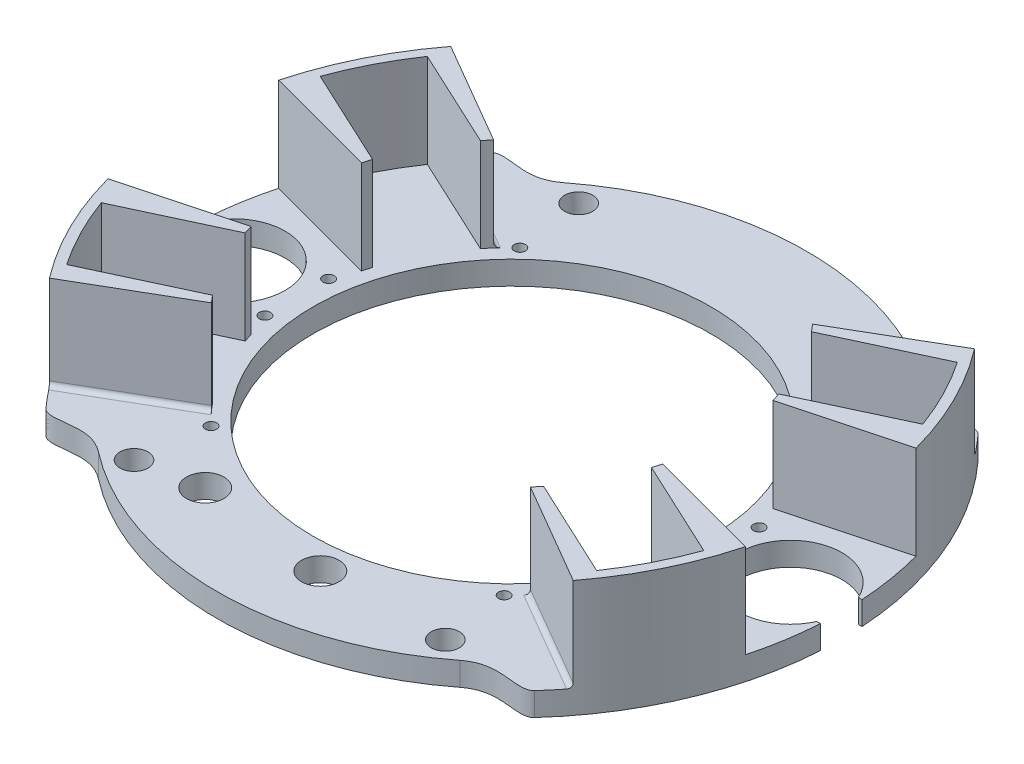
from build123d import *
from build123d.topology import SkipClean

# Parameters (mm, degrees)
SKETCH1_R                                    = 89.535
SKETCH1_R_2                                  = 53.975
BASE_DEPTH                                   = 6.35
NOCE_START                                   = -6.35
NOCE_CONE_PYROS_DEPTH                        = 6.35
BATTERY_1_HOLDER_DEPTH                       = 25.4
BATTERY_4_HOLDER_COPY_1_DEPTH                = 25.4
BATTERY_4_HOLDER_COPY_2_DEPTH                = 25.4
SKETCH4_R                                    = 3.81
BOLT_HOLE_DEPTH                              = 6.35
BOLT_HOLE_4_COPY_1_SKETCH_R                  = 3.81
BOLT_HOLE_4_COPY_1_DEPTH                     = 6.35
BOLT_HOLE_4_COPY_2_SKETCH_R                  = 3.81
BOLT_HOLE_4_COPY_2_DEPTH                     = 6.35
SKETCH11_R                                   = 5.08
CUT_EXTRUDE2_DEPTH                           = 6.35
SKETCH13_R                                   = 3.175
CUT_EXTRUDE3_DEPTH                           = 3.175
SKETCH14_R                                   = 1.524
CUT_EXTRUDE4_DEPTH                           = 3.175
FILLET3_R                                    = 1.27
SKETCH15_R                                   = 1.524
HATCH_MOUNT_DEPTH                            = 6.35
HATCH_MOUNT_MIRROR_AT_THE_SECOND_PLANE_C_R   = 1.524
HATCH_MOUNT_MIRROR_AT_THE_SECOND_PLA_2_DEPTH = 6.35
NOTCH_START                                  = -6.35
NOTCH_DEPTH                                  = 6.35


# Read off the part's stored shape, not the designer's step: Notch
with BuildPart() as part:
    # Sketch1 → Base (new body)
    with BuildSketch(Plane(origin=(0, 0, 0), x_dir=(1, 0, 0), z_dir=(0, 1, 0))):
        with Locations(Location((0, 0, 0), (0, 0, 270))):
            Circle(SKETCH1_R)
        with Locations(Location((0, 0, 0), (0, 0, 270))):
            Circle(SKETCH1_R_2, mode=Mode.SUBTRACT)
    extrude(amount=BASE_DEPTH)

    # Sketch2 → Noce Cone Pyros (cut)
    with BuildSketch(Plane(origin=(0, 6.35, 0), x_dir=(1, 0, 0), z_dir=(0, 1, 0)).offset(NOCE_START)):
        with BuildLine():
            Line((89.3564, 5.652439), (88.3404, 5.652439))
            ThreePointArc((88.3404, 5.652439), (61.595, 0), (88.3404, -5.652439))
            Line((88.3404, -5.652439), (89.3564, -5.652439))
            ThreePointArc((89.3564, -5.652439), (89.490339, -2.82763), (89.535, 0))
            ThreePointArc((89.535, 0), (89.490339, 2.82763), (89.3564, 5.652439))
        make_face()
    noce_cone_pyros = extrude(amount=NOCE_CONE_PYROS_DEPTH, mode=Mode.SUBTRACT)

    # Nose Cone Pyro mirror: Noce Cone Pyros across plane
    add(noce_cone_pyros.mirror(Plane(origin=(0, 0, 0), x_dir=(0, 0, 1), z_dir=(1, 0, 0))), mode=Mode.SUBTRACT)

    # Sketch3 → Battery 1 Holder (add)
    with BuildSketch(Plane(origin=(0, 6.35, 0), x_dir=(1, 0, 0), z_dir=(0, 1, 0))):
        with BuildLine():
            ThreePointArc((55.138033, 17.288828), (55.489291, 16.125907), (55.816024, 14.955859))
            Line((55.816024, 14.955859), (86.484169, 23.173363))
            ThreePointArc((86.484169, 23.173363), (80.316454, 39.569982), (71.074049, 54.451775))
            Line((71.074049, 54.451775), (43.281478, 38.286027))
            ThreePointArc((43.281478, 38.286027), (44.112475, 37.325538), (44.922161, 36.347018))
            Line((44.922161, 36.347018), (71.924647, 48.938484))
            ThreePointArc((71.924647, 48.938484), (77.444747, 39.628792), (81.766133, 29.705715))
            Line((81.766133, 29.705715), (55.138033, 17.288828))
        make_face()
    battery_1_holder = extrude(amount=BATTERY_1_HOLDER_DEPTH)

    # Batery 2 Holder: Battery 1 Holder across plane
    add(battery_1_holder.mirror(Plane.XY))

    # Battery 3 Holder: Battery 1 Holder across plane
    with SkipClean():  # the faces are left unmerged after this step: merging them gives an invalid solid
        add(battery_1_holder.mirror(Plane(origin=(0, 0, 0), x_dir=(0, 0, 1), z_dir=(1, 0, 0))))

    # Battery 4 Holder copy 1 sketch → Battery 4 Holder copy 1 (add)
    with SkipClean():  # the faces are left unmerged after this step: merging them gives an invalid solid
        with BuildSketch(Plane(origin=(0, 6.35, 0), x_dir=(-1, 0, 0), z_dir=(0, 1, 0))):
            with BuildLine():
                ThreePointArc((55.138033, 17.288828), (55.489291, 16.125907), (55.816024, 14.955859))
                Line((55.816024, 14.955859), (86.484169, 23.173363))
                ThreePointArc((86.484169, 23.173363), (80.316454, 39.569982), (71.074049, 54.451775))
                Line((71.074049, 54.451775), (43.281478, 38.286027))
                ThreePointArc((43.281478, 38.286027), (44.112475, 37.325538), (44.922161, 36.347018))
                Line((44.922161, 36.347018), (71.924647, 48.938484))
                ThreePointArc((71.924647, 48.938484), (77.444747, 39.628792), (81.766133, 29.705715))
                Line((81.766133, 29.705715), (55.138033, 17.288828))
            make_face()
        extrude(amount=BATTERY_4_HOLDER_COPY_1_DEPTH)

    # Battery 4 Holder copy 2 sketch → Battery 4 Holder copy 2 (add)
    with SkipClean():  # the faces are left unmerged after this step: merging them gives an invalid solid
        with BuildSketch(Plane(origin=(0, 6.35, 0), x_dir=(-1, 0, 0), z_dir=(0, 1, 0))):
            with BuildLine():
                ThreePointArc((55.138033, -17.288828), (55.489291, -16.125907), (55.816024, -14.955859))
                Line((55.816024, -14.955859), (86.484169, -23.173363))
                ThreePointArc((86.484169, -23.173363), (80.316454, -39.569982), (71.074049, -54.451775))
                Line((71.074049, -54.451775), (43.281478, -38.286027))
                ThreePointArc((43.281478, -38.286027), (44.112475, -37.325538), (44.922161, -36.347018))
                Line((44.922161, -36.347018), (71.924647, -48.938484))
                ThreePointArc((71.924647, -48.938484), (77.444747, -39.628792), (81.766133, -29.705715))
                Line((81.766133, -29.705715), (55.138033, -17.288828))
            make_face()
        extrude(amount=BATTERY_4_HOLDER_COPY_2_DEPTH)

    # Sketch4 → Bolt Hole (cut)
    with SkipClean():  # the faces are left unmerged after this step: merging them gives an invalid solid
        with BuildSketch(Plane(origin=(0, 6.35, 0), x_dir=(1, 0, 0), z_dir=(0, 1, 0))):
            with Locations(Location((42.24964, 60.33874, 0), (0, 0, 270))):
                Circle(SKETCH4_R)
        bolt_hole = extrude(amount=-BOLT_HOLE_DEPTH, mode=Mode.SUBTRACT)

    # Bolt Hole 2: Bolt Hole across plane
    with SkipClean():  # the faces are left unmerged after this step: merging them gives an invalid solid
        add(bolt_hole.mirror(Plane.XY), mode=Mode.SUBTRACT)

    # Bolt Hole 3: Bolt Hole across plane
    with SkipClean():  # the faces are left unmerged after this step: merging them gives an invalid solid
        add(bolt_hole.mirror(Plane(origin=(0, 0, 0), x_dir=(0, 0, 1), z_dir=(1, 0, 0))), mode=Mode.SUBTRACT)

    # Bolt Hole 4 copy 1 sketch → Bolt Hole 4 copy 1 (cut)
    with SkipClean():  # the faces are left unmerged after this step: merging them gives an invalid solid
        with BuildSketch(Plane(origin=(0, 6.35, 0), x_dir=(-1, 0, 0), z_dir=(0, 1, 0))):
            with Locations(Location((42.24964, 60.33874, 0), (0, 0, 270))):
                Circle(BOLT_HOLE_4_COPY_1_SKETCH_R)
        extrude(amount=-BOLT_HOLE_4_COPY_1_DEPTH, mode=Mode.SUBTRACT)

    # Bolt Hole 4 copy 2 sketch → Bolt Hole 4 copy 2 (cut)
    with SkipClean():  # the faces are left unmerged after this step: merging them gives an invalid solid
        with BuildSketch(Plane(origin=(0, 6.35, 0), x_dir=(-1, 0, 0), z_dir=(0, 1, 0))):
            with Locations((42.24964, -60.33874)):
                Circle(BOLT_HOLE_4_COPY_2_SKETCH_R)
        extrude(amount=-BOLT_HOLE_4_COPY_2_DEPTH, mode=Mode.SUBTRACT)

    # Sketch11 → Cut-Extrude2 (cut)
    with SkipClean():  # the faces are left unmerged after this step: merging them gives an invalid solid
        with BuildSketch(Plane.XZ):
            with Locations(Location((9.128366, 61.145977, 0), (0, 0, 270))):
                Circle(SKETCH11_R)
            with Locations(Location((-26.059706, 57.209264, 0), (0, 0, 270))):
                Circle(SKETCH11_R)
        extrude(amount=-CUT_EXTRUDE2_DEPTH, mode=Mode.SUBTRACT)

    # Sketch13 → Cut-Extrude3 (cut)
    with SkipClean():  # the faces are left unmerged after this step: merging them gives an invalid solid
        with BuildSketch(Plane.XZ):
            with Locations(Location((39.7764, 41.91, 0), (0, 0, 270))):
                Circle(SKETCH13_R)
            with Locations(Location((-39.7764, 41.91, 0), (0, 0, 270))):
                Circle(SKETCH13_R)
        cut_extrude3 = extrude(amount=-CUT_EXTRUDE3_DEPTH, mode=Mode.SUBTRACT)

    # Sketch14 → Cut-Extrude4 (cut)
    with SkipClean():  # the faces are left unmerged after this step: merging them gives an invalid solid
        with BuildSketch(Plane.XZ.offset(-3.175)):
            with Locations(Location((39.7764, 41.91, 0), (0, 0, 270))):
                Circle(SKETCH14_R)
            with Locations(Location((-39.7764, 41.91, 0), (0, 0, 270))):
                Circle(SKETCH14_R)
        cut_extrude4 = extrude(amount=-CUT_EXTRUDE4_DEPTH, mode=Mode.SUBTRACT)

    # Mirror1: Cut-Extrude3, Cut-Extrude4 across plane
    with SkipClean():  # the faces are left unmerged after this step: merging them gives an invalid solid
        add(cut_extrude3.mirror(Plane.XY), mode=Mode.SUBTRACT)
        add(cut_extrude4.mirror(Plane.XY), mode=Mode.SUBTRACT)

    # Fillet3
    # the kernel refuses this fillet: 1.27 mm, written as the material it adds along each edge
    with BuildSketch(Plane(origin=(-73.818547, 6.35, 56.048132), x_dir=(0.5027895932474892, 0, 0.8644088297339543), z_dir=(0.8644088297339544, 0, -0.5027895932474892))) as fillet3_piece_1_section:
        with BuildLine():
            CenterArc((FILLET3_R, -FILLET3_R), FILLET3_R, 90, 90)
            Line((0, -FILLET3_R), (0, 0))
            Line((0, 0), (FILLET3_R, 0))
        make_face()
    fillet3_piece_1 = extrude(amount=38.502113, mode=Mode.PRIVATE)
    fillet3_piece_1 = fillet3_piece_1 & Plane(origin=(0, 6.637419, 0), x_dir=(0, 0, 1), z_dir=(0, -1, 0)) * Cylinder(89.535, 83, mode=Mode.PRIVATE)
    fillet3_piece_1 = fillet3_piece_1 - Plane(origin=(0, 6.637419, 0), x_dir=(-0.7490088761778874, 0, 0.6625599621217225), z_dir=(0, -1, 0)) * Cylinder(57.785, 83, mode=Mode.PRIVATE)
    add(fillet3_piece_1)
    with BuildSketch(Plane(origin=(73.818547, 6.35, -56.048132), x_dir=(-0.5027895932474892, 0, -0.8644088297339543), z_dir=(-0.8644088297339544, 0, 0.5027895932474892))) as fillet3_piece_2_section:
        with BuildLine():
            CenterArc((FILLET3_R, -FILLET3_R), FILLET3_R, 90, 90)
            Line((0, -FILLET3_R), (0, 0))
            Line((0, 0), (FILLET3_R, 0))
        make_face()
    fillet3_piece_2 = extrude(amount=38.502113, mode=Mode.PRIVATE)
    fillet3_piece_2 = fillet3_piece_2 - Plane(origin=(0, 6.637419, 0), x_dir=(0.7490088761778874, 0, -0.6625599621217225), z_dir=(0, -1, 0)) * Cylinder(57.785, 83, mode=Mode.PRIVATE)
    fillet3_piece_2 = fillet3_piece_2 & Plane(origin=(0, 6.637419, 0), x_dir=(0, 0, 1), z_dir=(0, -1, 0)) * Cylinder(89.535, 83, mode=Mode.PRIVATE)
    add(fillet3_piece_2)
    with BuildSketch(Plane(origin=(73.818547, 6.35, 56.048132), x_dir=(-0.5027895932474892, 0, 0.8644088297339543), z_dir=(-0.8644088297339544, 0, -0.5027895932474892))) as fillet3_piece_3_section:
        with BuildLine():
            CenterArc((FILLET3_R, FILLET3_R), FILLET3_R, 180, 90)
            Line((0, FILLET3_R), (0, 0))
            Line((0, 0), (FILLET3_R, 0))
        make_face()
    fillet3_piece_3 = extrude(amount=38.502113, mode=Mode.PRIVATE)
    fillet3_piece_3 = fillet3_piece_3 & Plane(origin=(0, 6.637418, 0), x_dir=(0, 0, 1), z_dir=(0, -1, 0)) * Cylinder(89.535, 83, mode=Mode.PRIVATE)
    fillet3_piece_3 = fillet3_piece_3 - Plane(origin=(0, 6.637418, 0), x_dir=(0.7490088761778874, 0, 0.6625599621217225), z_dir=(0, -1, 0)) * Cylinder(57.785, 83, mode=Mode.PRIVATE)
    add(fillet3_piece_3)
    with BuildSketch(Plane(origin=(-73.818547, 6.35, -56.048132), x_dir=(0.5027895932474892, 0, -0.8644088297339543), z_dir=(0.8644088297339544, 0, 0.5027895932474892))) as fillet3_piece_4_section:
        with BuildLine():
            CenterArc((FILLET3_R, FILLET3_R), FILLET3_R, 180, 90)
            Line((0, FILLET3_R), (0, 0))
            Line((0, 0), (FILLET3_R, 0))
        make_face()
    fillet3_piece_4 = extrude(amount=38.502113, mode=Mode.PRIVATE)
    fillet3_piece_4 = fillet3_piece_4 & Plane(origin=(0, 6.637418, 0), x_dir=(0, 0, 1), z_dir=(0, -1, 0)) * Cylinder(89.535, 83, mode=Mode.PRIVATE)
    fillet3_piece_4 = fillet3_piece_4 - Plane(origin=(0, 6.637418, 0), x_dir=(-0.7490088761778874, 0, -0.6625599621217225), z_dir=(0, -1, 0)) * Cylinder(57.785, 83, mode=Mode.PRIVATE)
    add(fillet3_piece_4)

    # Sketch15 → Hatch Mount (cut)
    with BuildSketch(Plane.XZ):
        with Locations(Location((58.42, 8.636, 0), (0, 0, 270))):
            Circle(SKETCH15_R)
    hatch_mount = extrude(amount=-HATCH_MOUNT_DEPTH, mode=Mode.SUBTRACT)

    # Hatch Mount Mirror: Hatch Mount across plane
    add(hatch_mount.mirror(Plane.XY), mode=Mode.SUBTRACT)

    # Hatch Mount Mirror at the second plane: Hatch Mount across plane
    add(hatch_mount.mirror(Plane(origin=(0, 0, 0), x_dir=(0, 0, 1), z_dir=(1, 0, 0))), mode=Mode.SUBTRACT)

    # Hatch Mount Mirror at the second plane c → Hatch Mount Mirror at the second pla 2 (cut)
    with BuildSketch(Plane(origin=(0, 0, 0), x_dir=(-1, 0, 0), z_dir=(0, -1, 0))):
        with Locations(Location((58.42, 8.636, 0), (0, 0, 270))):
            Circle(HATCH_MOUNT_MIRROR_AT_THE_SECOND_PLANE_C_R)
    extrude(amount=-HATCH_MOUNT_MIRROR_AT_THE_SECOND_PLA_2_DEPTH, mode=Mode.SUBTRACT)

    # Notch outline → Notch (cut)
    with BuildSketch(Plane.XZ.offset(NOTCH_START)):
        with BuildLine():
            add(Edge.make_bspline(
                [(-49.086269, 63.18337), (-49.579263, 62.80037), (-50.639539, 62.089967), (-52.789427, 61.088962), (-55.493385, 60.549529), (-58.311087, 60.649432), (-60.696521, 60.958106), (-62.798759, 61.174293), (-64.219476, 61.131591), (-65.050271, 60.957751), (-65.528105, 60.777939), (-65.847779, 60.586818), (-66.090334, 60.390554), (-66.221721, 60.259503), (-66.281509, 60.193669)],
                knots=[0, 0, 0, 0, 0.0625, 0.125, 0.25, 0.375, 0.5, 0.625, 0.75, 0.8125, 0.875, 0.9375, 0.96875, 1, 1, 1, 1], degree=3))
            ThreePointArc((-49.086269, 63.18337), (0, 80.01), (49.086269, 63.18337))
            add(Edge.make_bspline(
                [(66.281509, 60.193669), (66.177137, 60.308596), (65.934978, 60.526151), (65.461752, 60.803132), (64.549877, 61.079859), (62.796412, 61.141975), (60.622983, 60.949673), (58.173517, 60.689325), (55.368284, 60.637651), (52.720223, 61.158908), (50.604322, 62.12181), (49.567378, 62.809603), (49.086269, 63.18337)],
                knots=[0, 0, 0, 0, 0.0625, 0.125, 0.25, 0.375, 0.5, 0.625, 0.75, 0.875, 0.9375, 1, 1, 1, 1], degree=3))
            ThreePointArc((66.281509, 60.193669), (0, 89.535), (-66.281509, 60.193669))
        make_face()
    notch = extrude(amount=NOTCH_DEPTH, mode=Mode.SUBTRACT)

    # Notch Mirror: Notch across plane
    add(notch.mirror(Plane.XY), mode=Mode.SUBTRACT)


solid = part.part
